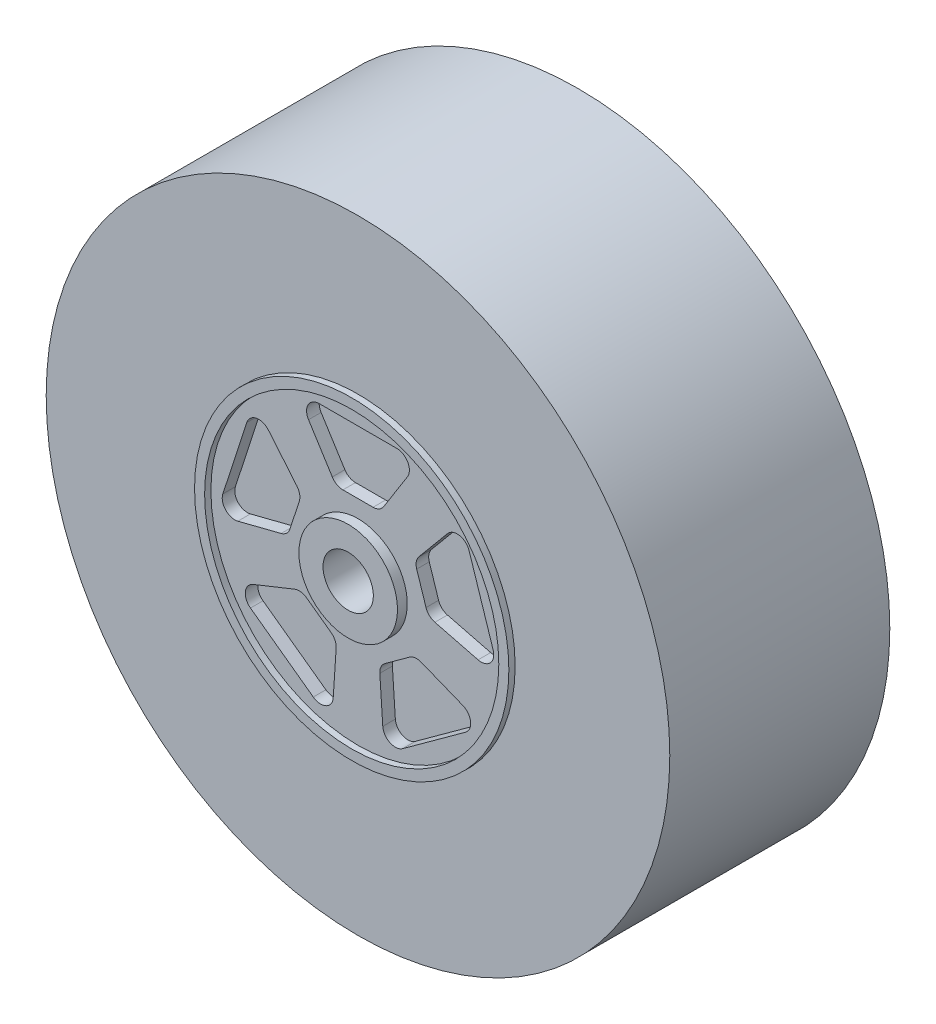
from build123d import *
from build123d.topology import SkipClean

# Parameters (mm, degrees)
SKETCH1_R             = 24.8
SKETCH1_R_2           = 2
BOSS_EXTRUDE1_DEPTH   = 8.75
BOSS_EXTRUDE3_START   = 0.5
SKETCH3_R             = 12.5
SKETCH3_R_2           = 2
BOSS_EXTRUDE3_DEPTH   = 0.5
CUT_EXTRUDE1_DEPTH    = 1.5
CIRPATTERN1_COUNT     = 5
SKETCH5_R             = 11.7
CUT_EXTRUDE2_DEPTH    = 0.5
BOSS_EXTRUDE4_START   = 0.78
SKETCH6_R             = 3.92
SKETCH6_R_2           = 2
BOSS_EXTRUDE4_DEPTH   = 0.78
MIRROR1_START         = 7.75
MIRROR1_DEPTH         = 1
MIRROR1_START_2       = 8.75
MIRROR1_2_OUTLINE_R   = 12.5
MIRROR1_2_OUTLINE_R_2 = 11.7
MIRROR1_2_OUTLINE_R_3 = 3.92
MIRROR1_2_OUTLINE_R_4 = 2
MIRROR1_2_DEPTH       = 0.5
MIRROR1_START_3       = 9.25
MIRROR1_3_OUTLINE_R   = 3.92
MIRROR1_3_OUTLINE_R_2 = 2
MIRROR1_3_DEPTH       = 0.28


# Read off the part's stored shape, not the designer's step: Mirror1
with BuildPart() as part:
    # Sketch1 → Boss-Extrude1 (new, symmetric)
    with BuildSketch(Plane.XY):
        Circle(SKETCH1_R)
        Circle(SKETCH1_R_2, mode=Mode.SUBTRACT)
    extrude(amount=BOSS_EXTRUDE1_DEPTH, both=True)

    # Sketch3 → Boss-Extrude3 (add)
    with SkipClean():  # the faces are left unmerged after this step: merging them gives an invalid solid
        with BuildSketch(Plane(origin=(0, 0, -8.75), x_dir=(-1, 0, 0), z_dir=(0, 0, -1)).offset(BOSS_EXTRUDE3_START)):
            with Locations(Location((0, 0, 0), (0, 0, 180))):
                Circle(SKETCH3_R)
            Circle(SKETCH3_R_2, mode=Mode.SUBTRACT)
        extrude(amount=-BOSS_EXTRUDE3_DEPTH)

    # Sketch4 → Cut-Extrude1 (cut)
    with SkipClean():  # the faces are left unmerged after this step: merging them gives an invalid solid
        with BuildSketch(Plane(origin=(0, 0, -9.25), x_dir=(-1, 0, 0), z_dir=(0, 0, -1))):
            with BuildLine():
                Line((-3.088094758, 10.3), (3.088094758, 10.3))
                ThreePointArc((3.088094758, 10.3), (3.963605368, 9.783198895), (3.934186276, 8.766962344))
                Line((3.934186276, 8.766962344), (2.044186276, 5.766962344))
                ThreePointArc((2.044186276, 5.766962344), (1.681293653, 5.42448939), (1.198094758, 5.3))
                Line((1.198094758, 5.3), (-1.198094758, 5.3))
                ThreePointArc((-1.198094758, 5.3), (-1.681293653, 5.42448939), (-2.044186276, 5.766962344))
                Line((-2.044186276, 5.766962344), (-3.934186276, 8.766962344))
                ThreePointArc((-3.934186276, 8.766962344), (-3.963605368, 9.783198895), (-3.088094758, 10.3))
            make_face()
        cut_extrude1 = extrude(amount=-CUT_EXTRUDE1_DEPTH, mode=Mode.SUBTRACT)

    # CirPattern1: Cut-Extrude1 ×5 about axis
    with SkipClean():  # the faces are left unmerged after this step: merging them gives an invalid solid
        cirpattern1_axis = Axis((0, 0, 0), (0, 0, 1))
        for i in range(1, CIRPATTERN1_COUNT):
            add(cut_extrude1.rotate(cirpattern1_axis, i * 360 / CIRPATTERN1_COUNT), mode=Mode.SUBTRACT)

    # Sketch5 → Cut-Extrude2 (cut)
    with BuildSketch(Plane(origin=(0, 0, -9.25), x_dir=(-1, 0, 0), z_dir=(0, 0, -1))):
        Circle(SKETCH5_R)
    extrude(amount=-CUT_EXTRUDE2_DEPTH, mode=Mode.SUBTRACT)

    # Sketch6 → Boss-Extrude4 (add)
    with BuildSketch(Plane(origin=(0, 0, -8.75), x_dir=(-1, 0, 0), z_dir=(0, 0, -1)).offset(BOSS_EXTRUDE4_START)):
        with Locations(Location((0, 0, 0), (0, 0, 180))):
            Circle(SKETCH6_R)
        Circle(SKETCH6_R_2, mode=Mode.SUBTRACT)
    extrude(amount=-BOSS_EXTRUDE4_DEPTH)

    # Mirror1 outline → Mirror1 (cut)
    with BuildSketch(Plane.XY.offset(MIRROR1_START)):
        with BuildLine():
            Line((-1.970267616, -9.405078198), (-1.735953979, -5.867113088))
            ThreePointArc((-1.735953979, -5.867113088), (-1.828239727, -5.376743716), (-2.145982817, -4.9920125))
            Line((-2.145982817, -4.9920125), (-4.084540858, -3.58356764))
            ThreePointArc((-4.084540858, -3.58356764), (-4.548630003, -3.400264488), (-5.043516853, -3.464027996))
            Line((-5.043516853, -3.464027996), (-8.33591473, -4.780164852))
            ThreePointArc((-8.33591473, -4.780164852), (-8.957044133, -5.585025384), (-8.552509238, -6.517738485))
            Line((-8.552509238, -6.517738485), (-3.555866959, -10.148011599))
            ThreePointArc((-3.555866959, -10.148011599), (-2.543795928, -10.244522947), (-1.970267616, -9.405078198))
        make_face()
        with BuildLine():
            Line((8.33591473, -4.780164852), (5.043516853, -3.464027996))
            ThreePointArc((5.043516853, -3.464027996), (4.548630003, -3.400264488), (4.084540858, -3.58356764))
            Line((4.084540858, -3.58356764), (2.145982817, -4.9920125))
            ThreePointArc((2.145982817, -4.9920125), (1.828239727, -5.376743716), (1.735953979, -5.867113088))
            Line((1.735953979, -5.867113088), (1.970267616, -9.405078198))
            ThreePointArc((1.970267616, -9.405078198), (2.543795928, -10.244522947), (3.555866959, -10.148011599))
            Line((3.555866959, -10.148011599), (8.552509238, -6.517738485))
            ThreePointArc((8.552509238, -6.517738485), (8.957044133, -5.585025384), (8.33591473, -4.780164852))
        make_face()
        with BuildLine():
            Line((7.122146247, 6.450773848), (4.853018817, 3.726226049))
            ThreePointArc((4.853018817, 3.726226049), (4.639447671, 3.275264692), (4.670367895, 2.777245897))
            Line((4.670367895, 2.777245897), (5.410831178, 0.498334243))
            ThreePointArc((5.410831178, 0.498334243), (5.678544293, 0.077254123), (6.116395415, -0.162047309))
            Line((6.116395415, -0.162047309), (9.553607084, -1.032493141))
            ThreePointArc((9.553607084, -1.032493141), (10.529196477, -0.746437996), (10.750155878, 0.245922399))
            Line((10.750155878, 0.245922399), (8.841608357, 6.119827685))
            ThreePointArc((8.841608357, 6.119827685), (8.079553641, 6.792787431), (7.122146247, 6.450773848))
        make_face()
        with BuildLine():
            Line((-3.934186276, 8.766962344), (-2.044186276, 5.766962344))
            ThreePointArc((-2.044186276, 5.766962344), (-1.681293653, 5.42448939), (-1.198094758, 5.3))
            Line((-1.198094758, 5.3), (1.198094758, 5.3))
            ThreePointArc((1.198094758, 5.3), (1.681293653, 5.42448939), (2.044186276, 5.766962344))
            Line((2.044186276, 5.766962344), (3.934186276, 8.766962344))
            ThreePointArc((3.934186276, 8.766962344), (3.963605368, 9.783198895), (3.088094758, 10.3))
            Line((3.088094758, 10.3), (-3.088094758, 10.3))
            ThreePointArc((-3.088094758, 10.3), (-3.963605368, 9.783198895), (-3.934186276, 8.766962344))
        make_face()
        with BuildLine():
            Line((-9.553607084, -1.032493141), (-6.116395415, -0.162047309))
            ThreePointArc((-6.116395415, -0.162047309), (-5.678544293, 0.077254123), (-5.410831178, 0.498334243))
            Line((-5.410831178, 0.498334243), (-4.670367895, 2.777245897))
            ThreePointArc((-4.670367895, 2.777245897), (-4.639447671, 3.275264692), (-4.853018817, 3.726226049))
            Line((-4.853018817, 3.726226049), (-7.122146247, 6.450773848))
            ThreePointArc((-7.122146247, 6.450773848), (-8.079553641, 6.792787431), (-8.841608357, 6.119827685))
            Line((-8.841608357, 6.119827685), (-10.750155878, 0.245922399))
            ThreePointArc((-10.750155878, 0.245922399), (-10.529196477, -0.746437996), (-9.553607084, -1.032493141))
        make_face()
    extrude(amount=MIRROR1_DEPTH, mode=Mode.SUBTRACT)

    # Mirror1 2 outline → Mirror1 2 (add)
    # profile 1 of 2: a face of its own
    with BuildSketch(Plane.XY.offset(MIRROR1_START_2)):
        Circle(MIRROR1_2_OUTLINE_R)
        Circle(MIRROR1_2_OUTLINE_R_2, mode=Mode.SUBTRACT)
    # profile 2 of 2: a face of its own
    with BuildSketch(Plane.XY.offset(MIRROR1_START_2)):
        Circle(MIRROR1_2_OUTLINE_R_3)
        Circle(MIRROR1_2_OUTLINE_R_4, mode=Mode.SUBTRACT)
    extrude(amount=MIRROR1_2_DEPTH)

    # Mirror1 3 outline → Mirror1 3 (add)
    with BuildSketch(Plane.XY.offset(MIRROR1_START_3)):
        Circle(MIRROR1_3_OUTLINE_R)
        Circle(MIRROR1_3_OUTLINE_R_2, mode=Mode.SUBTRACT)
    extrude(amount=MIRROR1_3_DEPTH)


solid = part.part
